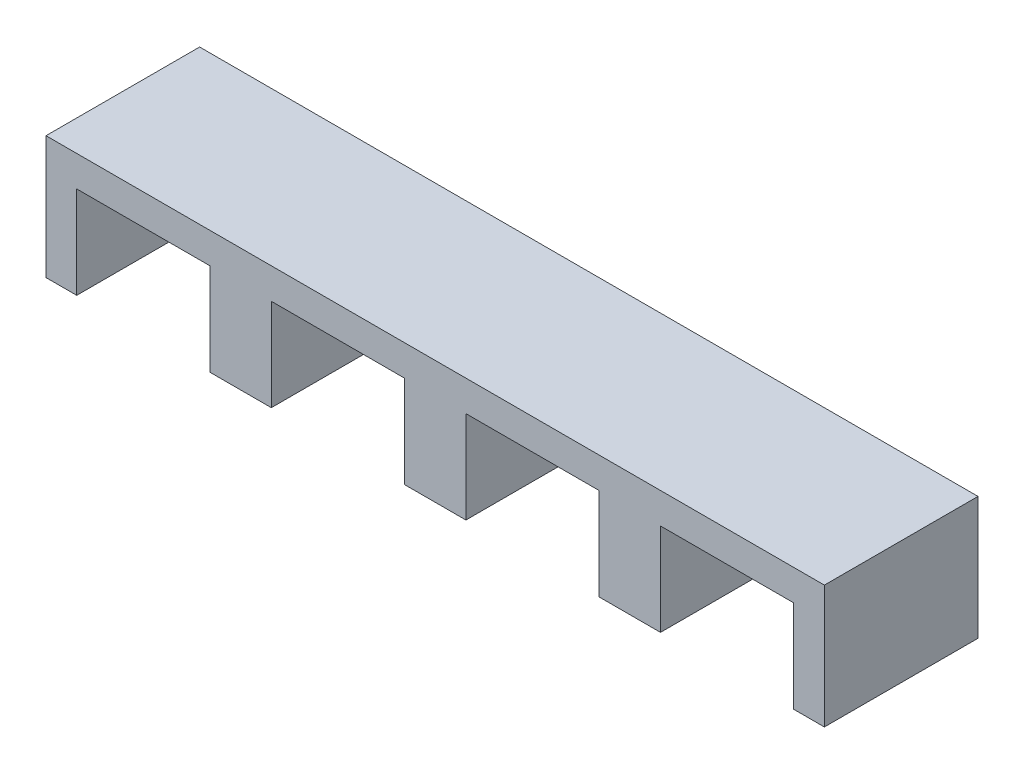
from build123d import *

# Parameters (mm, degrees)
MAIN_DEPTH = 15


with BuildPart() as part:
    # Esquisse1 → Main (new body)
    with BuildSketch(Plane.XY):
        Polygon((3, 0), (3, 9), (16, 9), (16, 0), (22, 0), (22, 9), (35, 9), (35, 0), (41, 0), (41, 9), (54, 9), (54, 0), (60, 0), (60, 9), (73, 9), (73, 0), (76, 0), (76, 12), (0, 12), (0, 0), align=None)
    extrude(amount=MAIN_DEPTH)


solid = part.part
